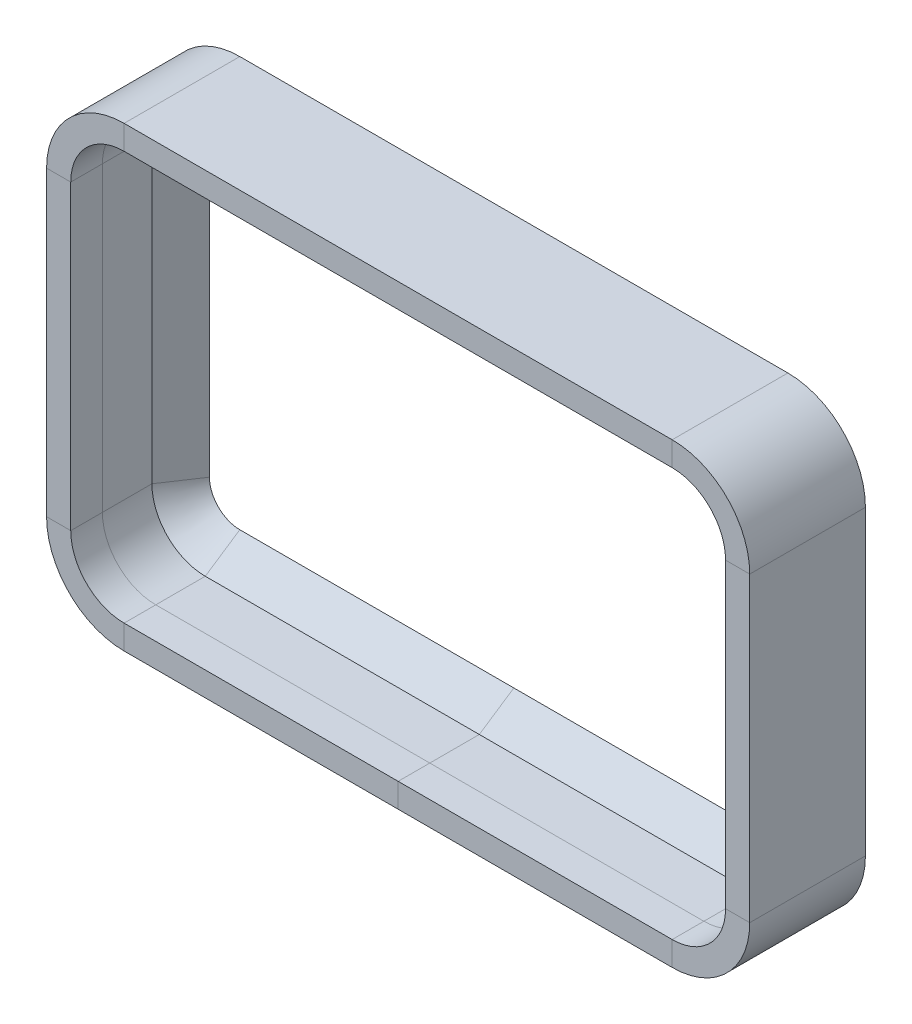
from build123d import *


with BuildPart() as part:
    # Balayage1: sweep along a path in Esquisse1
    with BuildLine(Plane.XY) as balayage1_path:
        Line((-39.634177347, 31.830613733), (39.634177347, 31.830613733))
        ThreePointArc((39.634177347, 31.830613733), (46.705245159, 28.901681545), (49.634177347, 21.830613733))
        Line((49.634177347, 21.830613733), (49.634177347, -21.830613733))
        ThreePointArc((49.634177347, -21.830613733), (46.705245159, -28.901681545), (39.634177347, -31.830613733))
        Line((39.634177347, -31.830613733), (-39.634177347, -31.830613733))
        ThreePointArc((-39.634177347, -31.830613733), (-46.705245159, -28.901681545), (-49.634177347, -21.830613733))
        Line((-49.634177347, -21.830613733), (-49.634177347, 21.830613733))
        ThreePointArc((-49.634177347, 21.830613733), (-46.705245159, 28.901681545), (-39.634177347, 31.830613733))
    # Esquisse2 → Balayage1 (sweep)
    with BuildSketch(Plane(origin=(0, 0, 0), x_dir=(0, 0, -1), z_dir=(1, 0, 0))):
        Polygon((-2.081082608, -29.55137304), (5.077841565, -29.55137304), (10.072439825, -26.221640867), (10.072439825, -33.047591823), (-6.659464347, -33.047591823), (-6.659464347, -29.55137304), align=None)
    sweep(path=balayage1_path.line)


solid = part.part
